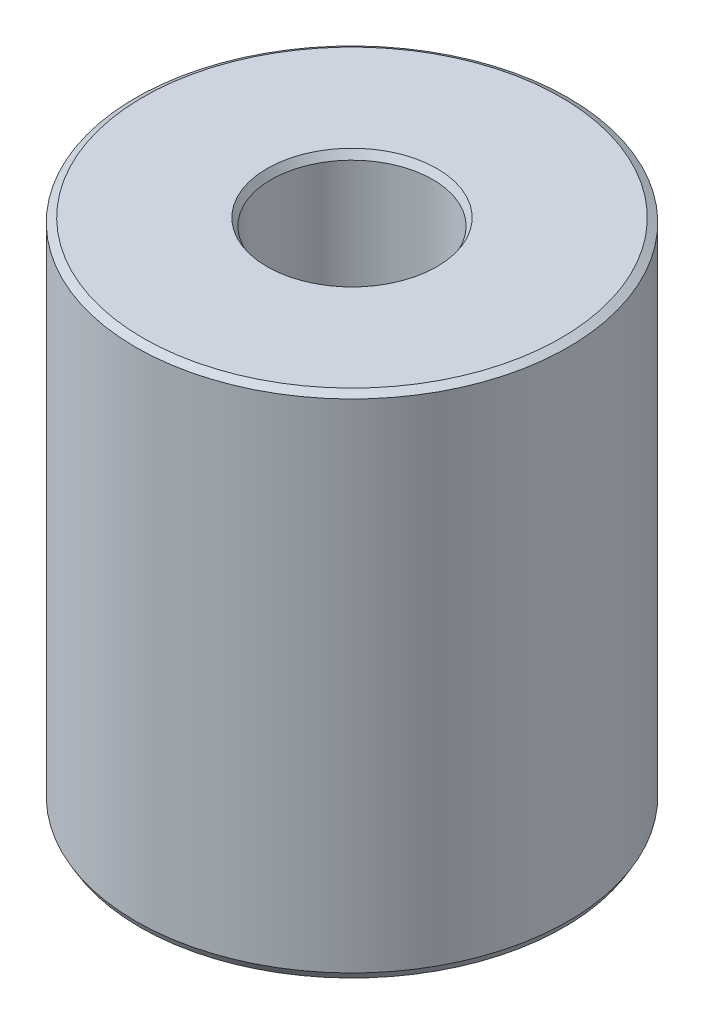
from build123d import *
from OCP.BRepFilletAPI import BRepFilletAPI_MakeChamfer

# Parameters (mm, degrees)
SKETCH1_R           = 22.5
BOSS_EXTRUDE1_DEPTH = 52.939973361
SKETCH2_R           = 8.403772211
CUT_EXTRUDE1_DEPTH  = 62.766825881
CHAMFER1_SIZE       = 0.442145343
CHAMFER1_SIZE2      = 0.765818198


with BuildPart() as part:
    # Sketch1 → Boss-Extrude1 (new body)
    with BuildSketch(Plane(origin=(0, 0, 0), x_dir=(1, 0, 0), z_dir=(0, 1, 0))):
        Circle(SKETCH1_R)
    extrude(amount=BOSS_EXTRUDE1_DEPTH)

    # Sketch2 → Cut-Extrude1 (cut, through all)
    with BuildSketch(Plane(origin=(0, 0, 0), x_dir=(1, 0, 0), z_dir=(0, 1, 0))):
        Circle(SKETCH2_R)
    extrude(amount=CUT_EXTRUDE1_DEPTH, mode=Mode.SUBTRACT)

    # Chamfer1: one chamfer whose edges measure the first distance from different faces: ONE call of the kernel's chamfer builder (chamfer() names one face for all edges)
    chamfer1_edges_1 = [part.edges().sort_by_distance(p)[0] for p in [
        (-8.403772211, 52.939973361, 0),
    ]]
    chamfer1_side_1 = [part.faces().sort_by_distance(p)[0] for p in [
        (-21.863603897, 52.939973361, 0),
    ]]
    chamfer1_edges_2 = [part.edges().sort_by_distance(p)[0] for p in [
        (-8.403772211, 0, 0),
    ]]
    chamfer1_side_2 = [part.faces().sort_by_distance(p)[0] for p in [
        (-8.403772211, 26.46998668, 0),
    ]]
    chamfer1_edges_3 = [part.edges().sort_by_distance(p)[0] for p in [
        (-22.5, 0, 0),
    ]]
    chamfer1_side_3 = [part.faces().sort_by_distance(p)[0] for p in [
        (-21.863603897, 0, 0),
    ]]
    chamfer1_edges_4 = [part.edges().sort_by_distance(p)[0] for p in [
        (-22.5, 52.939973361, 0),
    ]]
    chamfer1_side_4 = [part.faces().sort_by_distance(p)[0] for p in [
        (-22.5, 26.46998668, 0),
    ]]
    chamfer1 = BRepFilletAPI_MakeChamfer(part.part.solid().wrapped)
    for e in chamfer1_edges_1:
        chamfer1.Add(CHAMFER1_SIZE, CHAMFER1_SIZE2, e.wrapped, chamfer1_side_1[0].wrapped)  # the first distance lies on this face
    for e in chamfer1_edges_2:
        chamfer1.Add(CHAMFER1_SIZE, CHAMFER1_SIZE2, e.wrapped, chamfer1_side_2[0].wrapped)  # the first distance lies on this face
    for e in chamfer1_edges_3:
        chamfer1.Add(CHAMFER1_SIZE, CHAMFER1_SIZE2, e.wrapped, chamfer1_side_3[0].wrapped)  # the first distance lies on this face
    for e in chamfer1_edges_4:
        chamfer1.Add(CHAMFER1_SIZE, CHAMFER1_SIZE2, e.wrapped, chamfer1_side_4[0].wrapped)  # the first distance lies on this face
    add(Compound.cast(chamfer1.Shape()), mode=Mode.REPLACE)


solid = part.part
